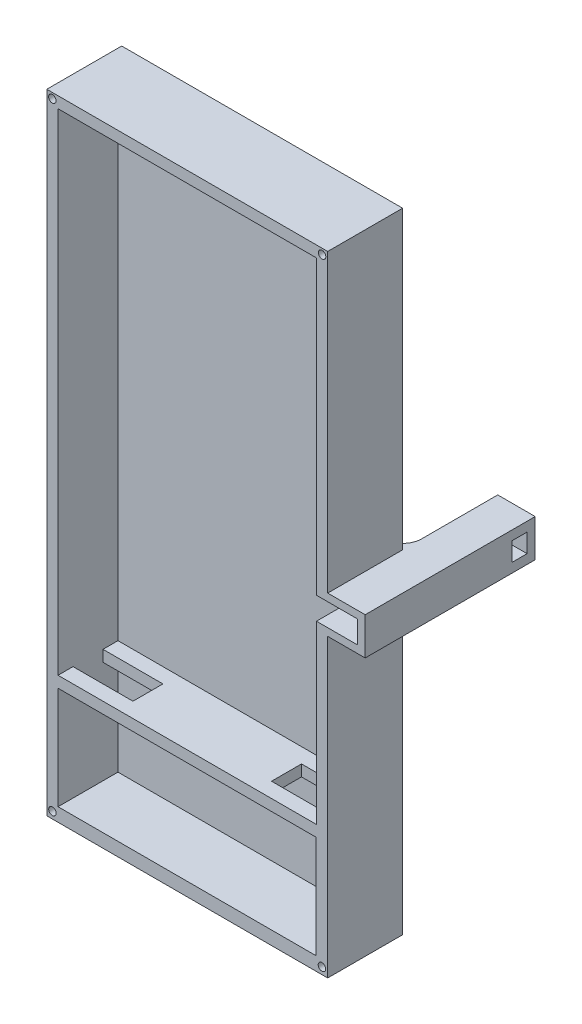
from build123d import *

# Parameters (mm, degrees)
SKETCH1_W           = 75
SKETCH1_H           = 168
BOSS_EXTRUDE1_DEPTH = 20
BOSS_EXTRUDE2_DEPTH = 10
SKETCH3_W           = 6
SKETCH3_H           = 6
CUT_EXTRUDE2_DEPTH  = 39.37
SKETCH6_W           = 4
SKETCH6_H           = 5
CUT_EXTRUDE4_DEPTH  = 5
SKETCH7_W           = 69
SKETCH7_H           = 131
CUT_EXTRUDE5_DEPTH  = 16
SKETCH8_W           = 68.924591969
SKETCH8_H           = 27.4
CUT_EXTRUDE6_DEPTH  = 16
SKETCH9_W           = 16
SKETCH9_H           = 8
CUT_EXTRUDE7_DEPTH  = 16
SKETCH11_W          = 7.457157679
SKETCH11_H          = 6
CUT_EXTRUDE8_DEPTH  = 16
BOSS_EXTRUDE3_DEPTH = 10
FILLET4_START       = -3
FILLET4_DEPTH       = 6
FILLET4_START_2     = -50
FILLET4_2_DEPTH     = 131
FILLET5_R           = 2.2
SKETCH13_W          = 7
SKETCH13_H          = 18
BOSS_EXTRUDE4_DEPTH = 8
SKETCH14_W          = 2
SKETCH14_H          = 12.5
CUT_EXTRUDE9_DEPTH  = 99.169037889
SKETCH15_W          = 2
SKETCH15_H          = 12.5
CUT_EXTRUDE10_DEPTH = 99.169037889
SKETCH17_R          = 1
CUT_EXTRUDE11_DEPTH = 2


with BuildPart() as part:
    # Sketch1 → Boss-Extrude1 (new body)
    with BuildSketch(Plane.XY):
        Rectangle(SKETCH1_W, SKETCH1_H)
    extrude(amount=BOSS_EXTRUDE1_DEPTH)

    # Sketch7 → Cut-Extrude5 (cut)
    with BuildSketch(Plane.XY.offset(20)):
        with Locations((0, 15.5)):
            Rectangle(SKETCH7_W, SKETCH7_H)
    extrude(amount=-CUT_EXTRUDE5_DEPTH, mode=Mode.SUBTRACT)

    # Sketch8 → Cut-Extrude6 (cut)
    with BuildSketch(Plane.XY.offset(20)):
        with Locations((-0.037704015, -66.7)):
            Rectangle(SKETCH8_W, SKETCH8_H)
    extrude(amount=-CUT_EXTRUDE6_DEPTH, mode=Mode.SUBTRACT)

    # Sketch9 → Cut-Extrude7 (cut)
    with BuildSketch(Plane(origin=(0, -50, 0), x_dir=(1, 0, 0), z_dir=(0, 1, 0))):
        with Locations((-26.5, -12)):
            Rectangle(SKETCH9_W, SKETCH9_H)
        with Locations((26.5, -12)):
            Rectangle(SKETCH9_W, SKETCH9_H)
    extrude(amount=-CUT_EXTRUDE7_DEPTH, mode=Mode.SUBTRACT)


with BuildPart() as body_2:
    # Sketch2 → Boss-Extrude2 (new body)
    with BuildSketch(Plane(origin=(37.5, 0, 0), x_dir=(0, 0, -1), z_dir=(1, 0, 0))):
        Polygon((0, 5), (25.4, 5), (25.4, -5), (0, -5), (-20, -5), (-20, 5), align=None)
    extrude(amount=BOSS_EXTRUDE2_DEPTH)

    # Sketch3 → Cut-Extrude2 (cut)
    with BuildSketch(Plane.XY.offset(20)):
        with Locations((42.5, 0)):
            Rectangle(SKETCH3_W, SKETCH3_H)
    extrude(amount=-CUT_EXTRUDE2_DEPTH, mode=Mode.SUBTRACT)

    # Sketch6 → Cut-Extrude4 (cut)
    with BuildSketch(Plane(origin=(47.5, 0, 0), x_dir=(0, 0, -1), z_dir=(1, 0, 0))):
        with Locations((21.230369208, 0)):
            Rectangle(SKETCH6_W, SKETCH6_H)
    extrude(amount=-CUT_EXTRUDE4_DEPTH, mode=Mode.SUBTRACT)


with BuildPart() as cut_extrude8_tool:
    # Sketch11 → Cut-Extrude8 (new body)
    with BuildSketch(Plane.XY.offset(20)):
        with Locations((35.77142116, 0)):
            Rectangle(SKETCH11_W, SKETCH11_H)
    extrude(amount=-CUT_EXTRUDE8_DEPTH)


with BuildPart() as part_1:
    add(part.part)

    # Cut-Extrude8: cut by cut_extrude8_tool
    add(cut_extrude8_tool.part, mode=Mode.SUBTRACT)



with BuildPart() as body_2_1:
    add(body_2.part)

    # Cut-Extrude8: cut by cut_extrude8_tool
    add(cut_extrude8_tool.part, mode=Mode.SUBTRACT)


with BuildPart() as part_2:
    add(part_1.part)

    add(body_2_1.part)  # Boss-Extrude3 merges body 2
    # Sketch12 → Boss-Extrude3 (add)
    with BuildSketch(Plane.XZ.offset(5)):
        with BuildLine():
            Line((32.42, 0), (37.5, 0))
            Line((37.5, 0), (37.5, -5.08))
            ThreePointArc((37.5, -5.08), (36.012102448, -1.487897552), (32.42, 0))
        make_face()
    extrude(amount=-BOSS_EXTRUDE3_DEPTH)

    # Fillet4: read off the stored shape, not the designer's step
    # Fillet4 outline → Fillet4 (cut)
    with BuildSketch(Plane(origin=(0, 0, 0), x_dir=(1, 0, 0), z_dir=(0, 1, 0)).offset(FILLET4_START)):
        with BuildLine():
            Line((34.42, -4), (39.5, -4))
            Line((39.5, -4), (39.5, 1.08))
            ThreePointArc((39.5, 1.08), (38.012102448, -2.512102448), (34.42, -4))
        make_face()
    extrude(amount=FILLET4_DEPTH, mode=Mode.SUBTRACT)

    # Fillet4 2 outline → Fillet4 2 (cut)
    with BuildSketch(Plane(origin=(0, 0, 0), x_dir=(1, 0, 0), z_dir=(0, 1, 0)).offset(FILLET4_START_2)):
        with BuildLine():
            ThreePointArc((34.5, -3.99937004), (34.46000124, -3.999842507), (34.42, -4))
            Line((34.42, -4), (34.5, -4))
            Line((34.5, -4), (34.5, -3.99937004))
        make_face()
    extrude(amount=FILLET4_2_DEPTH, mode=Mode.SUBTRACT)

    # Fillet5
    fillet5_edges = [part_2.edges().sort_by_distance(p)[0] for p in [
        (42.5, 0, -19.37),
    ]]
    fillet(fillet5_edges, radius=FILLET5_R)

    # Sketch13 → Boss-Extrude4 (add)
    with BuildSketch(Plane(origin=(0, 0, 0), x_dir=(-1, 0, 0), z_dir=(0, 0, -1))):
        with Locations((0, 42)):
            Rectangle(SKETCH13_W, SKETCH13_H)
        with Locations((0, -42)):
            Rectangle(SKETCH13_W, SKETCH13_H)
    extrude(amount=BOSS_EXTRUDE4_DEPTH)

    # Sketch14 → Cut-Extrude9 (cut, through all)
    with BuildSketch(Plane(origin=(3.5, 0, 0), x_dir=(0, 0, -1), z_dir=(1, 0, 0))):
        with Locations((4, 42)):
            Rectangle(SKETCH14_W, SKETCH14_H)
    extrude(amount=-CUT_EXTRUDE9_DEPTH, mode=Mode.SUBTRACT)

    # Sketch15 → Cut-Extrude10 (cut, through all)
    with BuildSketch(Plane(origin=(3.5, 0, 0), x_dir=(0, 0, -1), z_dir=(1, 0, 0))):
        with Locations((4, -42)):
            Rectangle(SKETCH15_W, SKETCH15_H)
    extrude(amount=-CUT_EXTRUDE10_DEPTH, mode=Mode.SUBTRACT)

    # Sketch17 → Cut-Extrude11 (cut)
    with BuildSketch(Plane.XY.offset(20)):
        with Locations((-36.034629261, 82.534629261)):
            Circle(SKETCH17_R)
        with Locations((36, 82.5)):
            Circle(SKETCH17_R)
        with Locations((35.962295985, -82.2)):
            Circle(SKETCH17_R)
        with Locations((-36, -82.2)):
            Circle(SKETCH17_R)
    extrude(amount=-CUT_EXTRUDE11_DEPTH, mode=Mode.SUBTRACT)


solid = part_2.part
